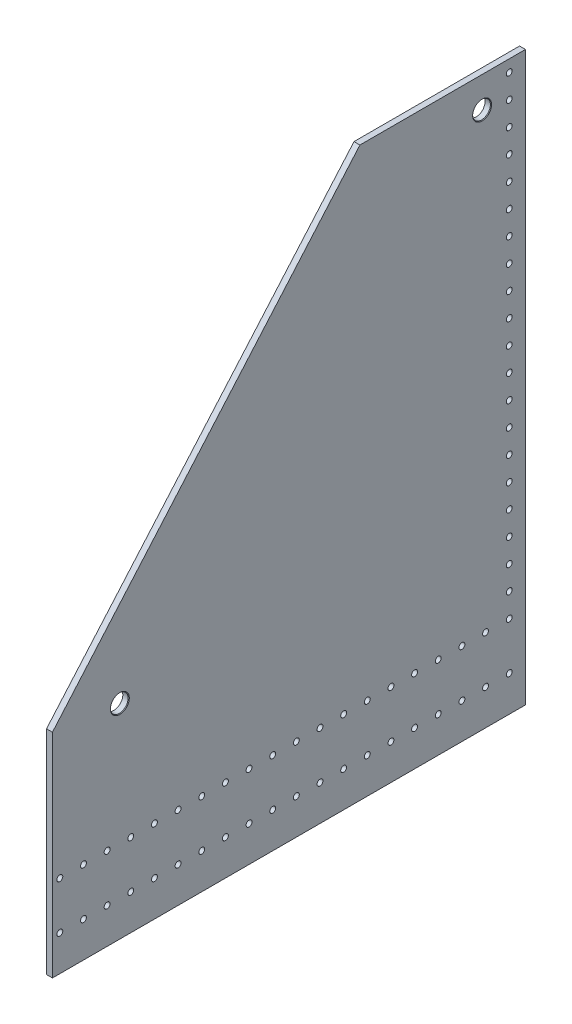
from build123d import *

# Parameters (mm, degrees)
SKETCH1_W                            = 508
SKETCH1_H                            = 609.6
BOSS_EXTRUDE1_DEPTH                  = 6.35
CUT_EXTRUDE1_DEPTH                   = 6.35
F_3_4_0_75_DIAMETER_HOLE1_AT_2_COUNT = 2
F_3_4_0_75_DIAMETER_HOLE1_AT_2_PITCH = 528.299128293
F_1_4_0_25_DIAMETER_HOLE1_D          = 6.35
LPATTERN2_OUTLINE_R                  = 3.175
LPATTERN2_DEPTH                      = 6.35


# Read off the part's stored shape, not the designer's step: LPattern2
with BuildPart() as part:
    # Sketch1 → Boss-Extrude1 (new body)
    with BuildSketch(Plane(origin=(0, 0, 0), x_dir=(0, 0, -1), z_dir=(1, 0, 0))):
        with Locations((167.525841453, -255.907437784)):
            Rectangle(SKETCH1_W, SKETCH1_H)
    extrude(amount=BOSS_EXTRUDE1_DEPTH)

    # Sketch4 → Cut-Extrude1 (cut)
    with BuildSketch(Plane(origin=(6.35, 0, 0), x_dir=(0, 0, -1), z_dir=(1, 0, 0))):
        Polygon((-86.474158547, 48.892562216), (243.725841453, 48.892562216), (-86.474158547, -332.107437784), align=None)
    extrude(amount=-CUT_EXTRUDE1_DEPTH, mode=Mode.SUBTRACT)

    # Sketch6 → 3/4 (0.75) Diameter Hole1 (revolve, cut)
    with BuildSketch(Plane(origin=(6.35, -341.632437784, 14.084158547), x_dir=(0, 0, -1), z_dir=(0, 1, 0))):
        Polygon((0, 0), (0, 6.35), (9.525, 6.35), (9.525, 0.635), (10.16, 0), align=None)
    f_3_4_0_75_diameter_hole1 = revolve(axis=Axis((12.7, -341.632437784, 14.084158547), (-1, 0, 0)), mode=Mode.SUBTRACT)

    # 3/4 (0.75) Diameter Hole1 at 2: 3/4 (0.75) Diameter Hole1 ×2
    with Locations(*[Vector(0, 0.6765499642400948, -0.7363967313118156) * (i * F_3_4_0_75_DIAMETER_HOLE1_AT_2_PITCH) for i in range(1, F_3_4_0_75_DIAMETER_HOLE1_AT_2_COUNT)]):
        add(f_3_4_0_75_diameter_hole1, mode=Mode.SUBTRACT)

    # 1/4 (0.25) Diameter Hole1 (through all)
    with Locations(Plane(origin=(6.35, 0, 0), x_dir=(0, 0, -1), z_dir=(1, 0, 0))):
        with Locations((-78.536658547, -522.607437784), (-78.536658547, -471.807437784), (-53.136658547, -522.607437784), (-53.136658547, -471.807437784), (-27.736658547, -522.607437784), (-27.736658547, -471.807437784), (-2.336658547, -522.607437784), (-2.336658547, -471.807437784), (23.063341453, -522.607437784), (23.063341453, -471.807437784), (48.463341453, -522.607437784), (48.463341453, -471.807437784), (73.863341453, -522.607437784), (73.863341453, -471.807437784), (99.263341453, -522.607437784), (99.263341453, -471.807437784), (124.663341453, -522.607437784), (124.663341453, -471.807437784), (150.063341453, -522.607437784), (150.063341453, -471.807437784), (175.463341453, -522.607437784), (175.463341453, -471.807437784), (200.863341453, -522.607437784), (200.863341453, -471.807437784), (226.263341453, -522.607437784), (226.263341453, -471.807437784), (251.663341453, -522.607437784), (251.663341453, -471.807437784), (277.063341453, -522.607437784), (277.063341453, -471.807437784), (302.463341453, -522.607437784), (302.463341453, -471.807437784), (327.863341453, -522.607437784), (327.863341453, -471.807437784), (353.263341453, -522.607437784), (353.263341453, -471.807437784), (378.663341453, -522.607437784), (378.663341453, -471.807437784), (404.063341453, -522.607437784), (404.063341453, -471.807437784)):
            Hole(F_1_4_0_25_DIAMETER_HOLE1_D / 2)

    # LPattern2 outline → LPattern2 (cut)
    with BuildSketch(Plane.YZ):
        with Locations((36.192562216, -404.063341453)):
            Circle(LPATTERN2_OUTLINE_R)
        with Locations((10.792562216, -404.063341453)):
            Circle(LPATTERN2_OUTLINE_R)
        with Locations((-14.607437784, -404.063341453)):
            Circle(LPATTERN2_OUTLINE_R)
        with Locations((-40.007437784, -404.063341453)):
            Circle(LPATTERN2_OUTLINE_R)
        with Locations((-65.407437784, -404.063341453)):
            Circle(LPATTERN2_OUTLINE_R)
        with Locations((-90.807437784, -404.063341453)):
            Circle(LPATTERN2_OUTLINE_R)
        with Locations((-116.207437784, -404.063341453)):
            Circle(LPATTERN2_OUTLINE_R)
        with Locations((-141.607437784, -404.063341453)):
            Circle(LPATTERN2_OUTLINE_R)
        with Locations((-167.007437784, -404.063341453)):
            Circle(LPATTERN2_OUTLINE_R)
        with Locations((-192.407437784, -404.063341453)):
            Circle(LPATTERN2_OUTLINE_R)
        with Locations((-217.807437784, -404.063341453)):
            Circle(LPATTERN2_OUTLINE_R)
        with Locations((-243.207437784, -404.063341453)):
            Circle(LPATTERN2_OUTLINE_R)
        with Locations((-268.607437784, -404.063341453)):
            Circle(LPATTERN2_OUTLINE_R)
        with Locations((-294.007437784, -404.063341453)):
            Circle(LPATTERN2_OUTLINE_R)
        with Locations((-319.407437784, -404.063341453)):
            Circle(LPATTERN2_OUTLINE_R)
        with Locations((-344.807437784, -404.063341453)):
            Circle(LPATTERN2_OUTLINE_R)
        with Locations((-370.207437784, -404.063341453)):
            Circle(LPATTERN2_OUTLINE_R)
        with Locations((-395.607437784, -404.063341453)):
            Circle(LPATTERN2_OUTLINE_R)
        with Locations((-421.007437784, -404.063341453)):
            Circle(LPATTERN2_OUTLINE_R)
        with Locations((-446.407437784, -404.063341453)):
            Circle(LPATTERN2_OUTLINE_R)
    extrude(amount=LPATTERN2_DEPTH, mode=Mode.SUBTRACT)


solid = part.part
